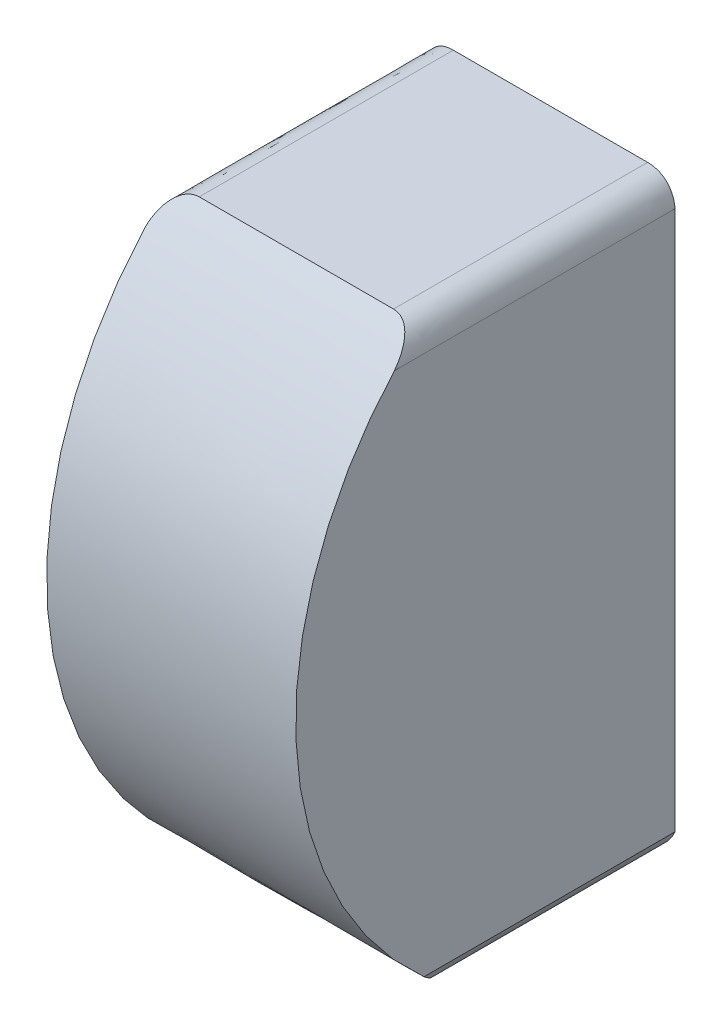
from build123d import *

# Parameters (mm, degrees)
LOFT1_START             = 259.08
LOFT1_DEPTH             = 1021.08
CUT_EXTRUDE1_DEPTH      = 1290.62122974
LPATTERN1_COUNT         = 15
LPATTERN1_PITCH         = 53.34
CUT_EXTRUDE4_DEPTH      = 1290.62122974
CUT_EXTRUDE4_DEPTH_BACK = 1290.62122974
SKETCH12_OUTSIDE_W      = 1232.81
SKETCH12_OUTSIDE_H      = 380.64
SKETCH13_W              = 691.165372795
SKETCH13_H              = 233.895042588
CUT_EXTRUDE5_DEPTH      = 360.661187802
SCALE1_SCALE            = 0.95


# Read off the part's stored shape, not the designer's step: Loft1
with BuildPart() as part:
    # Loft1 outline → Loft1 (new body)
    with BuildSketch(Plane.YZ.offset(LOFT1_START)):
        with BuildLine():
            add(Edge.make_bspline(
                [(131.074840176, 0), (131.074840176, 7.585349878), (129.019719734, 22.755453715), (119.988374686, 43.869012627), (105.663719284, 61.816756347), (87.077737999, 75.303505752), (65.572351994, 83.356423395), (42.699502143, 85.39357748), (20.108822767, 81.269408641), (6.324958878, 74.609028267), (-5.786480365, 66.591156976), (-16.410547257, 57.496977056), (-28.534928085, 40.377986455), (-36.116650435, 20.818386871), (-37.835159824, 6.939567352), (-37.835159824, -6.939567352), (-36.116650435, -20.818386871), (-28.534928085, -40.377986455), (-16.410547257, -57.496977056), (-5.786480365, -66.591156976), (6.324958878, -74.609028267), (20.108822767, -81.269408641), (42.699502143, -85.39357748), (65.572351994, -83.356423395), (87.077737999, -75.303505752), (105.663719284, -61.816756347), (119.988374686, -43.869012627), (129.019719734, -22.755453715), (131.074840176, -7.585349878), (131.074840176, 0)],
                knots=[0, 0, 0, 0, 0.04288364, 0.08576728, 0.12865092, 0.17153456, 0.2144182, 0.25730184, 0.30018548, 0.34306912, 0.34306912, 0.38230184, 0.42153456, 0.46076728, 0.5, 0.5, 0.53923272, 0.57846544, 0.61769816, 0.65693088, 0.65693088, 0.69981452, 0.74269816, 0.7855818, 0.82846544, 0.87134908, 0.91423272, 0.95711636, 1, 1, 1, 1], degree=3))
        make_face()
    extrude(amount=LOFT1_DEPTH)

    # Sketch10 (on Front Plane) → Cut-Extrude1 (cut, symmetric)
    with BuildSketch(Plane.XY):
        with BuildLine():
            Line((370.088452905, 78.026436792), (370.088452905, 52.620114122))
            add(Edge.make_bspline(
                [(370.088452905, 52.620114122), (370.995867627, 49.272576747), (375.115065094, 47.839862903)],
                knots=[0, 0, 0, 1, 1, 1], degree=2))
            Line((375.115065094, 47.839862903), (390.064888423, 47.839862903))
            add(Edge.make_bspline(
                [(395.091500612, 52.620114122), (394.184085889, 49.272576747), (390.064888423, 47.839862903)],
                knots=[0, 0, 0, 1, 1, 1], degree=2))
            Line((395.091500612, 52.620114122), (395.091500612, 78.026436792))
            add(Edge.make_bspline(
                [(390.064888423, 82.082511515), (392.217535458, 82.043682887), (394.561076709, 80.900159735), (395.091500612, 78.026436792)],
                knots=[0, 0, 0, 0, 1, 1, 1, 1], degree=3))
            Line((390.064888423, 82.082511515), (375.115065094, 82.082511515))
            add(Edge.make_bspline(
                [(375.115065094, 82.082511515), (372.962418059, 82.043682887), (370.618876808, 80.900159735), (370.088452905, 78.026436792)],
                knots=[0, 0, 0, 0, 1, 1, 1, 1], degree=3))
        make_face()
    cut_extrude1 = extrude(amount=CUT_EXTRUDE1_DEPTH, both=True, mode=Mode.SUBTRACT)

    # LPattern1: Cut-Extrude1 ×15
    with Locations(*[(i * LPATTERN1_PITCH, 0, 0) for i in range(1, LPATTERN1_COUNT)]):
        add(cut_extrude1, mode=Mode.SUBTRACT)

    # Sketch12 outside (on Front Plane) → Cut-Extrude4 (cut, two sides: drawn at the far end of the back side and taken through both)
    with BuildSketch(Plane.XY.offset(-CUT_EXTRUDE4_DEPTH_BACK)):
        with Locations((769.62, 46.62)):
            Rectangle(SKETCH12_OUTSIDE_W, SKETCH12_OUTSIDE_H)
        with BuildLine():
            Line((268.742092957, 103.434867576), (268.742092957, -16.712334523))
            add(Edge.make_bspline(
                [(268.742092957, -16.712334523), (270.508991838, -20.579782205), (273.059867475, -21.576401142), (275.945080305, -21.515503071)],
                knots=[0, 0, 0, 0, 1, 1, 1, 1], degree=3))
            Line((275.945080305, -21.515503071), (316.991660423, -21.515503071))
            add(Edge.make_bspline(
                [(324.194647772, -16.712334523), (322.42774889, -20.579782205), (319.876873253, -21.576401142), (316.991660423, -21.515503071)],
                knots=[0, 0, 0, 0, 1, 1, 1, 1], degree=3))
            Line((324.194647772, -16.712334523), (324.194647772, 103.434867576))
            add(Edge.make_bspline(
                [(324.194647772, 103.434867576), (324.037076707, 106.257728711), (322.158374039, 109.32203364), (318.096841472, 109.330384599)],
                knots=[0, 0, 0, 0, 1, 1, 1, 1], degree=3))
            Line((318.096841472, 109.330384599), (274.839899257, 109.330384599))
            add(Edge.make_bspline(
                [(268.742092957, 103.434867576), (268.899664021, 106.257728711), (270.77836669, 109.32203364), (274.839899257, 109.330384599)],
                knots=[0, 0, 0, 0, 1, 1, 1, 1], degree=3))
        make_face(mode=Mode.SUBTRACT)
    extrude(amount=CUT_EXTRUDE4_DEPTH + CUT_EXTRUDE4_DEPTH_BACK, mode=Mode.SUBTRACT)

    # Sketch13 → Cut-Extrude5 (cut, through all)
    with BuildSketch(Plane(origin=(0, 109.330384599, 0), x_dir=(1, 0, 0), z_dir=(0, 1, 0))):
        with Locations((345.582686398, 116.947521294)):
            Rectangle(SKETCH13_W, SKETCH13_H)
    extrude(amount=-CUT_EXTRUDE5_DEPTH, mode=Mode.SUBTRACT)


with BuildPart() as part_1:
    # Scale1: scaled about (296.468369915, 44.696953726, 38.055435363)
    add(part.part.scale(SCALE1_SCALE).moved(Location((14.823418496, 2.234847686, 1.902771768))))


solid = part_1.part
